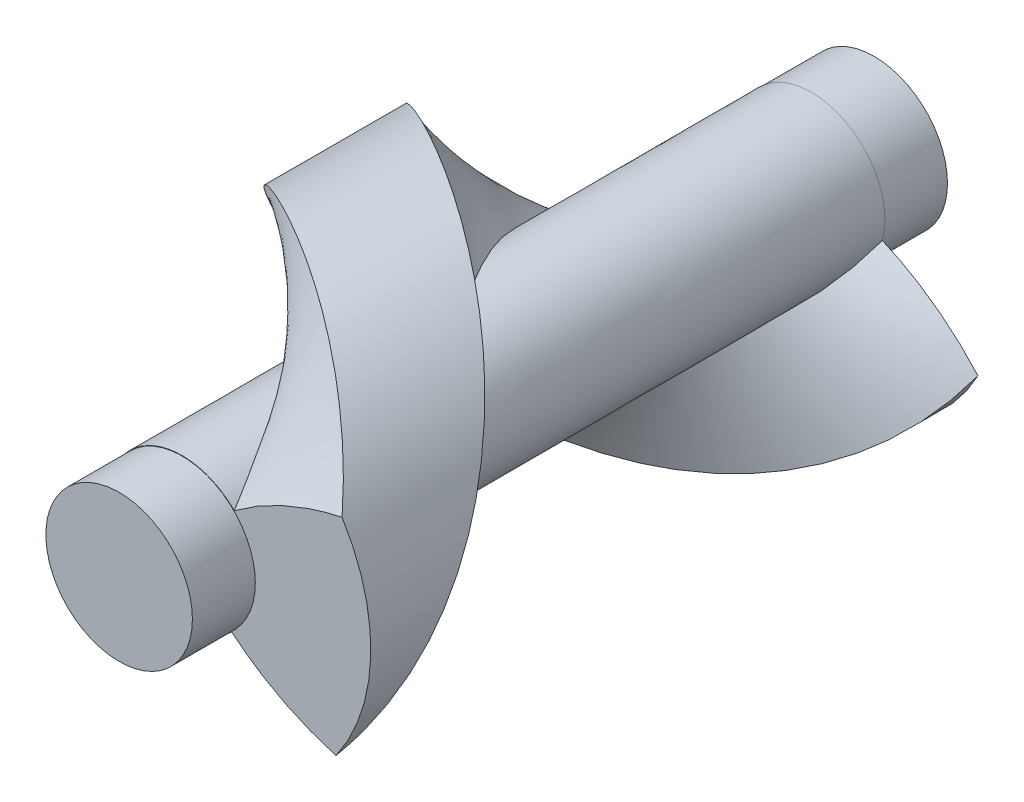
from build123d import *

# Parameters (mm, degrees)
SKETCH_1_2_R             = 30
EXTRUDE_1_DEPTH          = 120
SWEEP_1_PITCH            = 120
CUT_EXTRUDE_1_DEPTH      = 20
CUT_EXTRUDE_1_DEPTH_BACK = 20
SKETCH_5_R               = 30
SKETCH_9_R               = 11.645325779
EXTRUDE_2_DEPTH          = 10
EXTRUDE_START            = 10
SKETCH_10_R              = 11.645325779
EXTRUDE_3_DEPTH          = 10


with BuildPart() as part:
    # 草图1<2> → 凸台-拉伸1 (new body)
    with BuildSketch(Plane.XY):
        Circle(SKETCH_1_2_R)
    extrude(amount=EXTRUDE_1_DEPTH)

    # 切除-扫描1: arcs per turn and ends read off the stored shape
    # 切除-扫描1: the profile of 草图4 profile screwed along a left-hand helix through 2.5 turns, 36 arcs to a turn; built about Z, then put on its axis
    sweep_1_z = Axis((0, 0, 0), (0, 0, 1))
    sweep_1_corners = [(30.0003, 0, -169.323140108), (30.0003, 0, -71.799651347), (11.705348247, 0, -75.890127444), (11.705348247, 0, -165.038792071)]
    with BuildLine(mode=Mode.PRIVATE) as sweep_1_profile:
        Line(sweep_1_corners[0], sweep_1_corners[1])
        Line(sweep_1_corners[1], sweep_1_corners[2])
        Line(sweep_1_corners[2], sweep_1_corners[3])
        Line(sweep_1_corners[3], sweep_1_corners[0])
    sweep_1_cap = Face(sweep_1_profile.wire())
    sweep_1_turn_angles = [0, -5, -10, -15, -20, -25, -30, -35, -40, -45, -50, -55, -60, -65, -70, -75, -80, -85, -90, -95, -100, -105, -110, -115, -120, -125, -130, -135, -140, -145, -150, -155, -160, -165, -170, -175, -180, -185, -190, -195, -200, -205, -210, -215, -220, -225, -230, -235, -240, -245, -250, -255, -260, -265, -270, -275, -280, -285, -290, -295, -300, -305, -310, -315, -320, -325, -330, -335, -340, -345, -350, -355, -360]
    sweep_1_turn_weights = [1, 0.9961946980917455, 1, 0.9961946980917455, 1, 0.9961946980917455, 1, 0.9961946980917455, 1, 0.9961946980917455, 1, 0.9961946980917455, 1, 0.9961946980917455, 1, 0.9961946980917455, 1, 0.9961946980917455, 1, 0.9961946980917455, 1, 0.9961946980917455, 1, 0.9961946980917455, 1, 0.9961946980917455, 1, 0.9961946980917455, 1, 0.9961946980917455, 1, 0.9961946980917455, 1, 0.9961946980917455, 1, 0.9961946980917455, 1, 0.9961946980917455, 1, 0.9961946980917455, 1, 0.9961946980917455, 1, 0.9961946980917455, 1, 0.9961946980917455, 1, 0.9961946980917455, 1, 0.9961946980917455, 1, 0.9961946980917455, 1, 0.9961946980917455, 1, 0.9961946980917455, 1, 0.9961946980917455, 1, 0.9961946980917455, 1, 0.9961946980917455, 1, 0.9961946980917455, 1, 0.9961946980917455, 1, 0.9961946980917455, 1, 0.9961946980917455, 1, 0.9961946980917455, 1]
    sweep_1_turn_rails = [Edge.make_bspline([Vector(p[0], p[1], 0).rotate(sweep_1_z, sweep_1_turn_angles[k]) / sweep_1_turn_weights[k] + Vector(0, 0, p[2] + -SWEEP_1_PITCH * sweep_1_turn_angles[k] / 360) for k in range(73)], [0, 0, 0, 1, 1, 2, 2, 3, 3, 4, 4, 5, 5, 6, 6, 7, 7, 8, 8, 9, 9, 10, 10, 11, 11, 12, 12, 13, 13, 14, 14, 15, 15, 16, 16, 17, 17, 18, 18, 19, 19, 20, 20, 21, 21, 22, 22, 23, 23, 24, 24, 25, 25, 26, 26, 27, 27, 28, 28, 29, 29, 30, 30, 31, 31, 32, 32, 33, 33, 34, 34, 35, 35, 36, 36, 36], 2, sweep_1_turn_weights) for p in sweep_1_corners]
    sweep_1_turn_sides = [Face.make_surface_from_curves(sweep_1_turn_rails[p[0]], sweep_1_turn_rails[p[1]]) for p in [(0, 1), (1, 2), (2, 3), (3, 0)]]
    sweep_1_last_angles = [-720, -725, -730, -735, -740, -745, -750, -755, -760, -765, -770, -775, -780, -785, -790, -795, -800, -805, -810, -815, -820, -825, -830, -835, -840, -845, -850, -855, -860, -865, -870, -875, -880, -885, -890, -895, -900]
    sweep_1_last_weights = [1, 0.9961946980917455, 1, 0.9961946980917455, 1, 0.9961946980917455, 1, 0.9961946980917455, 1, 0.9961946980917455, 1, 0.9961946980917455, 1, 0.9961946980917455, 1, 0.9961946980917455, 1, 0.9961946980917455, 1, 0.9961946980917455, 1, 0.9961946980917455, 1, 0.9961946980917455, 1, 0.9961946980917455, 1, 0.9961946980917455, 1, 0.9961946980917455, 1, 0.9961946980917455, 1, 0.9961946980917455, 1, 0.9961946980917455, 1]
    sweep_1_last_rails = [Edge.make_bspline([Vector(p[0], p[1], 0).rotate(sweep_1_z, sweep_1_last_angles[k]) / sweep_1_last_weights[k] + Vector(0, 0, p[2] + -SWEEP_1_PITCH * sweep_1_last_angles[k] / 360) for k in range(37)], [0, 0, 0, 1, 1, 2, 2, 3, 3, 4, 4, 5, 5, 6, 6, 7, 7, 8, 8, 9, 9, 10, 10, 11, 11, 12, 12, 13, 13, 14, 14, 15, 15, 16, 16, 17, 17, 18, 18, 18], 2, sweep_1_last_weights) for p in sweep_1_corners]
    sweep_1_last_sides = [Face.make_surface_from_curves(sweep_1_last_rails[p[0]], sweep_1_last_rails[p[1]]) for p in [(0, 1), (1, 2), (2, 3), (3, 0)]]
    sweep_1 = Plane(origin=(0, 0, 0), x_dir=(-1, 0, 0), z_dir=(0, 0, 1)) * Solid(Shell([*[p.moved(Location((0, 0, SWEEP_1_PITCH * i))) for i in range(2) for p in sweep_1_turn_sides], *sweep_1_last_sides, sweep_1_cap, sweep_1_cap.rotate(sweep_1_z, -900).moved(Location((0, 0, -SWEEP_1_PITCH * -900 / 360)))]))
    add(sweep_1, mode=Mode.SUBTRACT)

    # 草图5 → 切除-拉伸1 (cut, two sides: drawn at the far end of the back side and taken through both)
    with BuildSketch(Plane.XY.offset(-CUT_EXTRUDE_1_DEPTH_BACK)):
        Circle(SKETCH_5_R)
    extrude(amount=CUT_EXTRUDE_1_DEPTH + CUT_EXTRUDE_1_DEPTH_BACK, mode=Mode.SUBTRACT)

    # 草图9 → 凸台-拉伸2 (add)
    with BuildSketch(Plane(origin=(0, 0, 20), x_dir=(-1, 0, 0), z_dir=(0, 0, -1))):
        with Locations(Location((0, 0, 0), (0, 0, 180))):
            Circle(SKETCH_9_R)
    extrude(amount=EXTRUDE_2_DEPTH)

    # 草图10 → 凸台-拉伸3 (add)
    with BuildSketch(Plane.XY.offset(120).offset(EXTRUDE_START)):
        Circle(SKETCH_10_R)
    extrude(amount=-EXTRUDE_3_DEPTH)


solid = part.part
